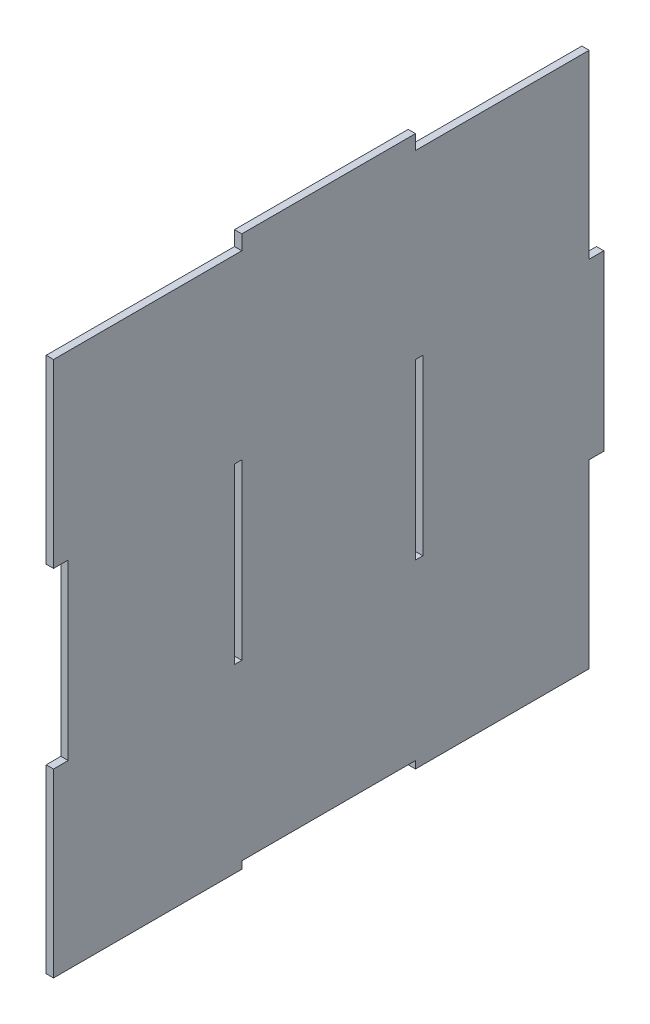
from build123d import *

# Parameters (mm, degrees)
SKETCH2_W           = 3.175
SKETCH2_H           = 75.333333334
BOSS_EXTRUDE1_DEPTH = 3.175
SKETCH3_W           = 3.175
SKETCH3_H           = 78.508333333
SKETCH3_W_2         = 75.333333334
SKETCH3_H_2         = 3.175
BOSS_EXTRUDE2_DEPTH = 3.175
SKETCH4_W           = 3.175
SKETCH4_H           = 78.508333333
CUT_EXTRUDE1_DEPTH  = 3.175


with BuildPart() as part:
    # Sketch2 → Boss-Extrude1 (new body)
    with BuildSketch(Plane(origin=(0, 0, 0), x_dir=(0, 0, -1), z_dir=(1, 0, 0))):
        Polygon((-113, 37.666666667), (-113, -37.666666667), (-116.175, -37.666666667), (-116.175, -116.175), (-37.666666667, -116.175), (-37.666666667, -113), (37.666666667, -113), (37.666666667, -116.175), (116.175, -116.175), (116.175, -37.666666667), (119.35, -37.666666667), (119.35, 37.666666667), (116.175, 37.666666667), (116.175, 116.175), (37.666666667, 116.175), (37.666666667, 119.35), (-37.666666667, 119.35), (-37.666666667, 116.175), (-116.175, 116.175), (-116.175, 37.666666667), align=None)
        with Locations((-39.254166667, 0)):
            Rectangle(SKETCH2_W, SKETCH2_H, mode=Mode.SUBTRACT)
        with Locations((39.254166667, 0)):
            Rectangle(SKETCH2_W, SKETCH2_H, mode=Mode.SUBTRACT)
    extrude(amount=BOSS_EXTRUDE1_DEPTH)

    # Sketch3 → Boss-Extrude2 (add)
    with BuildSketch(Plane(origin=(3.175, 0, 0), x_dir=(0, 0, -1), z_dir=(1, 0, 0))):
        with Locations((-117.7625, 76.920833334)):
            Rectangle(SKETCH3_W, SKETCH3_H)
        with Locations((-117.7625, -76.920833334)):
            Rectangle(SKETCH3_W, SKETCH3_H)
        with Locations((0, 120.9375)):
            Rectangle(SKETCH3_W_2, SKETCH3_H_2)
    extrude(amount=-BOSS_EXTRUDE2_DEPTH)

    # Sketch4 → Cut-Extrude1 (cut)
    with BuildSketch(Plane(origin=(3.175, 0, 0), x_dir=(0, 0, -1), z_dir=(1, 0, 0))):
        with Locations((114.5875, 76.920833334)):
            Rectangle(SKETCH4_W, SKETCH4_H)
        with Locations((114.5875, -76.920833334)):
            Rectangle(SKETCH4_W, SKETCH4_H)
    extrude(amount=-CUT_EXTRUDE1_DEPTH, mode=Mode.SUBTRACT)


solid = part.part
